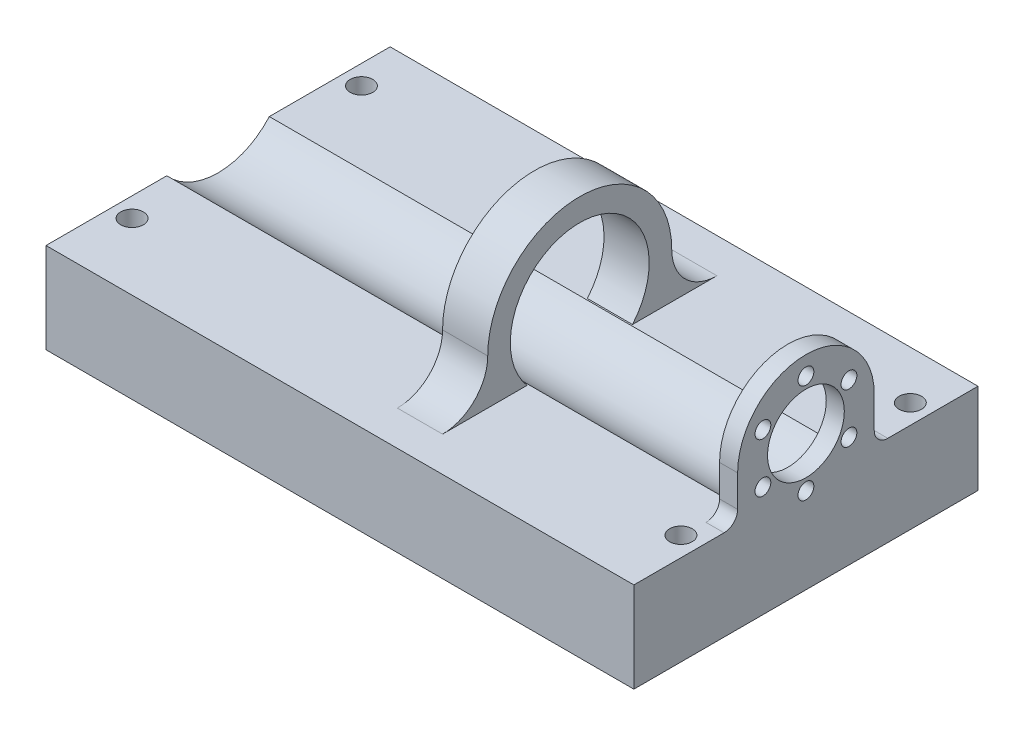
from build123d import *

# Parameters (mm, degrees)
SKETCH1_W           = 130.175
SKETCH1_H           = 76.2
BOSS_EXTRUDE1_DEPTH = 20
SKETCH2_R           = 15.125
CUT_EXTRUDE1_DEPTH  = 138.102664544
SKETCH3_R           = 15.125
BOSS_EXTRUDE2_DEPTH = 4
SKETCH4_R           = 1.75
CUT_EXTRUDE2_DEPTH  = 140.31262057
CIRPATTERN1_COUNT   = 6
SKETCH5_R           = 8.5
CUT_EXTRUDE3_DEPTH  = 143.945466
SKETCH6_R           = 2.5
CUT_EXTRUDE4_DEPTH  = 88.887759564
SKETCH8_R           = 20.375
SKETCH8_R_2         = 15.375
BOSS_EXTRUDE3_DEPTH = 5
BOSS_EXTRUDE4_DEPTH = 4
BOSS_EXTRUDE5_START = -5
BOSS_EXTRUDE5_DEPTH = 10
FILLET1_R           = 10
FILLET2_R           = 3


with BuildPart() as part:
    # Sketch1 → Boss-Extrude1 (new body)
    with BuildSketch(Plane(origin=(0, 0, 0), x_dir=(1, 0, 0), z_dir=(0, 1, 0))):
        Rectangle(SKETCH1_W, SKETCH1_H)
    extrude(amount=BOSS_EXTRUDE1_DEPTH)

    # Sketch2 → Cut-Extrude1 (cut, through all)
    with BuildSketch(Plane(origin=(65.0875, 0, 0), x_dir=(0, 0, -1), z_dir=(1, 0, 0))):
        with Locations((0, 30)):
            Circle(SKETCH2_R)
    extrude(amount=-CUT_EXTRUDE1_DEPTH, mode=Mode.SUBTRACT)

    # Sketch3 → Boss-Extrude2 (add)
    with BuildSketch(Plane(origin=(65.0875, 0, 0), x_dir=(0, 0, -1), z_dir=(1, 0, 0))):
        with Locations((0, 30)):
            Circle(SKETCH3_R)
    extrude(amount=-BOSS_EXTRUDE2_DEPTH)

    # Sketch4 → Cut-Extrude2 (cut, through all)
    with BuildSketch(Plane.ZY.offset(-61.0875)):
        with Locations((0, 41)):
            Circle(SKETCH4_R)
    cut_extrude2 = extrude(amount=-CUT_EXTRUDE2_DEPTH, mode=Mode.SUBTRACT)

    # CirPattern1: Cut-Extrude2 ×6 about axis
    cirpattern1_axis = Axis((0, 30, 0), (1, 0, 0))
    for i in range(1, CIRPATTERN1_COUNT):
        add(cut_extrude2.rotate(cirpattern1_axis, i * 360 / CIRPATTERN1_COUNT), mode=Mode.SUBTRACT)

    # Sketch5 → Cut-Extrude3 (cut, through all)
    with BuildSketch(Plane(origin=(65.0875, 0, 0), x_dir=(0, 0, -1), z_dir=(1, 0, 0))):
        with Locations((0, 30)):
            Circle(SKETCH5_R)
    extrude(amount=-CUT_EXTRUDE3_DEPTH, mode=Mode.SUBTRACT)

    # Sketch6 → Cut-Extrude4 (cut, through all)
    with BuildSketch(Plane.XZ):
        with Locations(Location((60.7695, 23.368, 0), (0, 0, 270))):
            Circle(SKETCH6_R)
        with Locations(Location((60.7695, -27.432, 0), (0, 0, 270))):
            Circle(SKETCH6_R)
    cut_extrude4 = extrude(amount=-CUT_EXTRUDE4_DEPTH, mode=Mode.SUBTRACT)

    # Mirror1: Cut-Extrude4 across plane
    add(cut_extrude4.mirror(Plane(origin=(0, 0, 0), x_dir=(0, 0, 1), z_dir=(1, 0, 0))), mode=Mode.SUBTRACT)

    # Sketch8 → Boss-Extrude3 (add, symmetric)
    with BuildSketch(Plane(origin=(10, 0, 0), x_dir=(0, 0, -1), z_dir=(1, 0, 0))):
        with Locations((0, 30)):
            Circle(SKETCH8_R)
        with Locations((0, 30)):
            Circle(SKETCH8_R_2, mode=Mode.SUBTRACT)
    extrude(amount=BOSS_EXTRUDE3_DEPTH, both=True)

    # Sketch9 → Boss-Extrude4 (add)
    with BuildSketch(Plane(origin=(65.0875, 0, 0), x_dir=(0, 0, -1), z_dir=(1, 0, 0))):
        with BuildLine():
            ThreePointArc((-11.347494217, 20), (-14.149142642, 24.655153184), (-15.125, 30))
            Line((-15.125, 30), (-15.125, 20))
            Line((-15.125, 20), (-11.347494217, 20))
        make_face()
        with BuildLine():
            Line((15.125, 20), (15.125, 30))
            ThreePointArc((15.125, 30), (14.149142642, 24.655153184), (11.347494217, 20))
            Line((11.347494217, 20), (15.125, 20))
        make_face()
    extrude(amount=-BOSS_EXTRUDE4_DEPTH)

    # Sketch10 → Boss-Extrude5 (add)
    with BuildSketch(Plane(origin=(10, 0, 0), x_dir=(0, 0, -1), z_dir=(1, 0, 0)).offset(BOSS_EXTRUDE5_START)):
        with BuildLine():
            ThreePointArc((-17.752200568, 20), (-19.708395566, 24.83088313), (-20.375, 30))
            Line((-20.375, 30), (-20.375, 20))
            Line((-20.375, 20), (-17.752200568, 20))
        make_face()
        with BuildLine():
            Line((20.375, 20), (20.375, 30))
            ThreePointArc((20.375, 30), (19.708395566, 24.83088313), (17.752200568, 20))
            Line((17.752200568, 20), (20.375, 20))
        make_face()
    extrude(amount=BOSS_EXTRUDE5_DEPTH)

    # Fillet1
    fillet1_edges = [part.edges().sort_by_distance(p)[0] for p in [
        (10, 20, -20.375),
        (10, 20, 20.375),
    ]]
    fillet(fillet1_edges, radius=FILLET1_R - 0.0001)  # a hair under: the kernel refuses the full size

    # Fillet2
    fillet2_edges = [part.edges().sort_by_distance(p)[0] for p in [
        (63.0875, 20, 15.125),
        (63.0875, 20, -15.125),
    ]]
    fillet(fillet2_edges, radius=FILLET2_R)


solid = part.part
